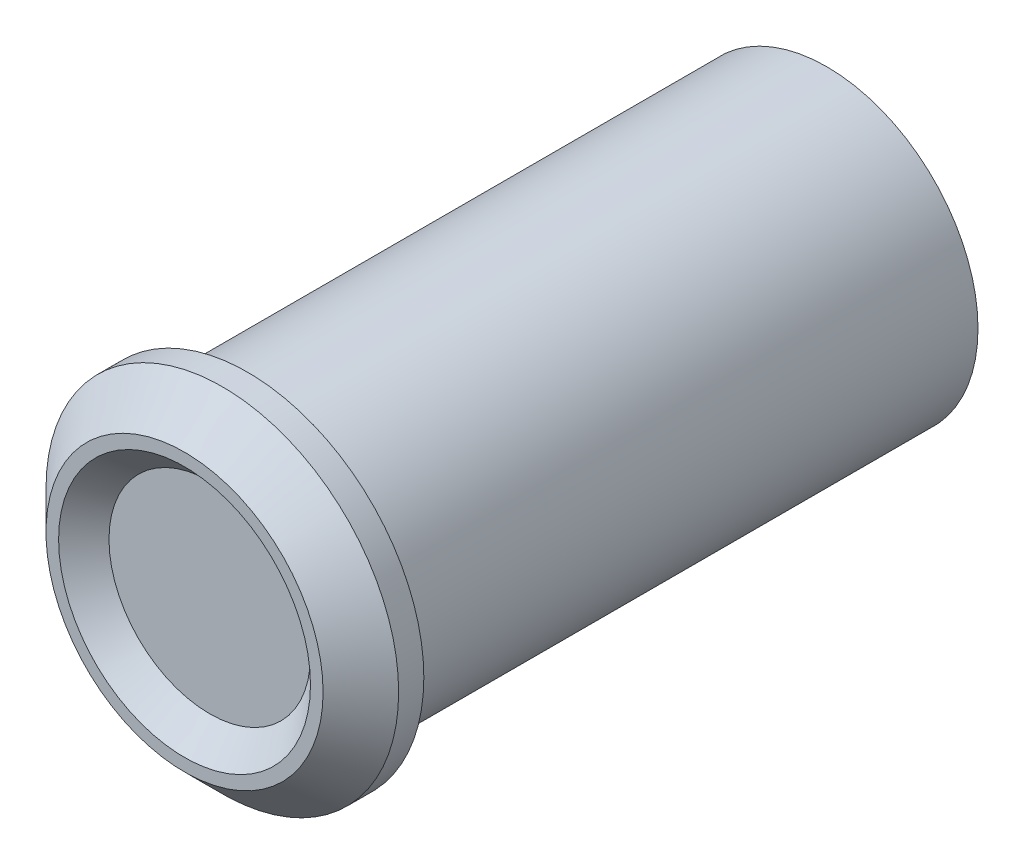
from build123d import *

# Parameters (mm, degrees)
SKETCH1_R           = 7
BOSS_EXTRUDE1_DEPTH = 1
SKETCH2_R           = 7
BOSS_EXTRUDE2_DEPTH = 1.5
BOSS_EXTRUDE2_TAPER = 45
SKETCH3_R           = 5
CUT_EXTRUDE1_DEPTH  = 1
CUT_EXTRUDE1_DRAFT  = -45
SKETCH4_R           = 6
BOSS_EXTRUDE3_DEPTH = 23


with BuildPart() as part:
    # Sketch1 → Boss-Extrude1 (new body)
    with BuildSketch(Plane.XY):
        Circle(SKETCH1_R)
    extrude(amount=BOSS_EXTRUDE1_DEPTH)

    # Sketch2 → Boss-Extrude2 (add)
    with BuildSketch(Plane.XY.offset(1)):
        Circle(SKETCH2_R)
    extrude(amount=BOSS_EXTRUDE2_DEPTH, taper=BOSS_EXTRUDE2_TAPER)


with BuildPart() as cut_extrude1_tool:
    # Sketch3 → Cut-Extrude1 (with draft: the straight prism first)
    with BuildSketch(Plane.XY.offset(2.5)):
        Circle(SKETCH3_R)
    extrude(amount=-CUT_EXTRUDE1_DEPTH)
    # Cut-Extrude1: the draft: its side faces are tilted about the plane it starts from
    cut_extrude1_sides = [cut_extrude1_tool.faces().sort_by_distance(p)[0] for p in [
        (-5, 0, 2),
    ]]
    draft(cut_extrude1_sides, Plane.XY.offset(2.5), CUT_EXTRUDE1_DRAFT)


with BuildPart() as part_1:
    add(part.part)

    # Cut-Extrude1: cut by cut_extrude1_tool
    add(cut_extrude1_tool.part, mode=Mode.SUBTRACT)

    # Sketch4 → Boss-Extrude3 (add)
    with BuildSketch(Plane.XY):
        Circle(SKETCH4_R)
    extrude(amount=-BOSS_EXTRUDE3_DEPTH)


solid = part_1.part
